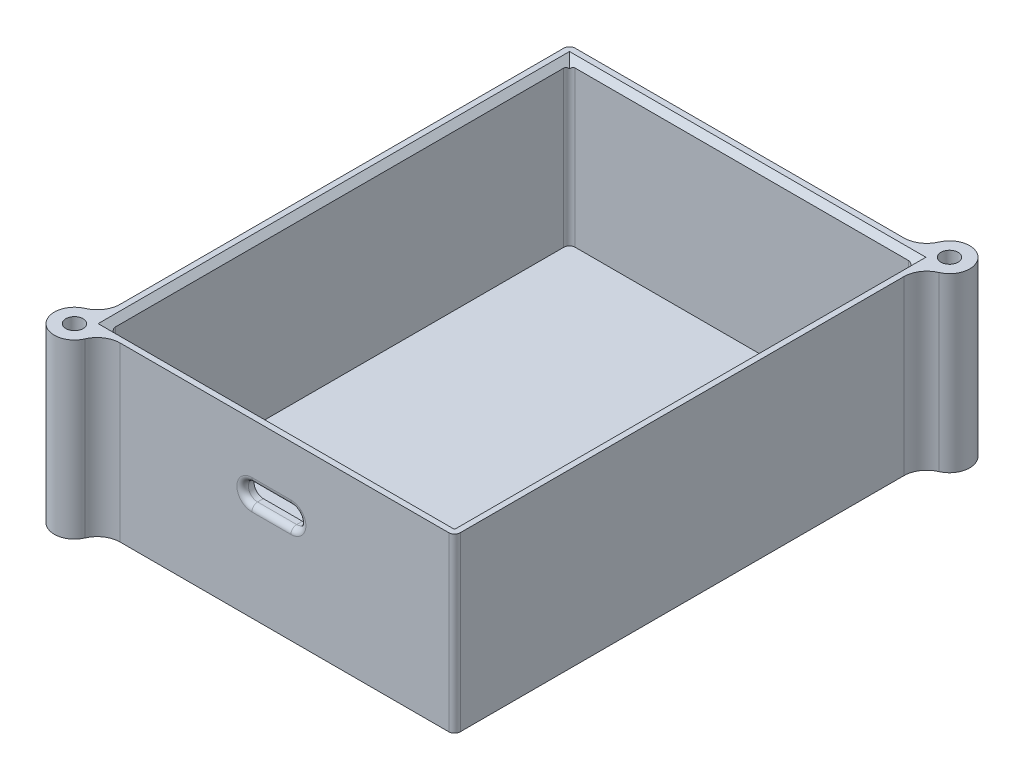
from build123d import *

# Parameters (mm, degrees)
SKETCH1_W           = 64
SKETCH1_H           = 84
SKETCH1_W_2         = 60
SKETCH1_H_2         = 80
BOSS_EXTRUDE1_DEPTH = 30
SKETCH2_R           = 3.5
SKETCH2_R_2         = 1.5
BOSS_EXTRUDE2_DEPTH = 30
CUT_EXTRUDE1_DEPTH  = 30
FILLET2_R           = 1
FILLET3_R           = 4
CHAMFER1_SIZE       = 1
FILLET4_R           = 1
FILLET5_R           = 1
BOSS_EXTRUDE3_REACH = 115.239
SKETCH6_W           = 82.053414124
SKETCH6_H           = 2


with BuildPart() as part:
    # Sketch1 → Boss-Extrude1 (new body)
    with BuildSketch(Plane(origin=(0, 0, 0), x_dir=(1, 0, 0), z_dir=(0, 1, 0))):
        with Locations((30, -40)):
            Rectangle(SKETCH1_W, SKETCH1_H)
        with Locations((30, -40)):
            Rectangle(SKETCH1_W_2, SKETCH1_H_2, mode=Mode.SUBTRACT)
    extrude(amount=BOSS_EXTRUDE1_DEPTH)

    # Sketch2 → Boss-Extrude2 (add)
    # profile 1 of 2: a face of its own
    with BuildSketch(Plane(origin=(0, 0, 0), x_dir=(1, 0, 0), z_dir=(0, 1, 0))):
        with Locations((-3.060660172, -83.060660172)):
            Circle(SKETCH2_R)
        with Locations((-3.060660172, -83.060660172)):
            Circle(SKETCH2_R_2, mode=Mode.SUBTRACT)
    # profile 2 of 2: a face of its own
    with BuildSketch(Plane(origin=(0, 0, 0), x_dir=(1, 0, 0), z_dir=(0, 1, 0))):
        with Locations((63.060660172, 3.060660172)):
            Circle(SKETCH2_R)
        with Locations((63.060660172, 3.060660172)):
            Circle(SKETCH2_R_2, mode=Mode.SUBTRACT)
    extrude(amount=BOSS_EXTRUDE2_DEPTH)

    # Sketch4 → Cut-Extrude1 (cut)
    with BuildSketch(Plane.XY.offset(82)):
        with BuildLine():
            Line((30.141314867, 20.2), (26.741314867, 20.2))
            ThreePointArc((26.741314867, 20.2), (25.141314867, 18.6), (26.741314867, 17))
            Line((26.741314867, 17), (30.141314867, 17))
            Line((30.141314867, 17), (33.541314867, 17))
            ThreePointArc((33.541314867, 17), (35.141314867, 18.6), (33.541314867, 20.2))
            Line((33.541314867, 20.2), (30.141314867, 20.2))
        make_face()
    extrude(amount=-CUT_EXTRUDE1_DEPTH, mode=Mode.SUBTRACT)

    # Fillet2
    fillet2_edges = [part.edges().sort_by_distance(p)[0] for p in [
        (25.141314867, 18.6, 82),
        (30.141314867, 20.2, 82),
        (35.141314867, 18.6, 82),
        (30.141314867, 17, 82),
    ]]
    fillet(fillet2_edges, radius=FILLET2_R)

    # Fillet3
    fillet3_edges = [part.edges().sort_by_distance(p)[0] for p in [
        (62, 15, 0.274755844),
        (59.725244156, 15, -2),
        (-2, 15, 79.725244156),
        (0.274755844, 15, 82),
    ]]
    fillet(fillet3_edges, radius=FILLET3_R)

    # Chamfer1
    chamfer1_edges = [part.edges().sort_by_distance(p)[0] for p in [
        (30, 30, 0),
        (60, 30, 40),
        (0, 30, 40),
        (30, 30, 80),
    ]]
    chamfer(chamfer1_edges, length=CHAMFER1_SIZE)

    # Fillet4
    fillet4_edges = [part.edges().sort_by_distance(p)[0] for p in [
        (-2, 15, -2),
        (62, 15, 82),
    ]]
    fillet(fillet4_edges, radius=FILLET4_R)

    # Fillet5
    fillet5_edges = [part.edges().sort_by_distance(p)[0] for p in [
        (60, 14.5, 80),
        (60, 14.5, 0),
        (0, 14.5, 0),
        (0, 14.5, 80),
    ]]
    fillet(fillet5_edges, radius=FILLET5_R)

    # Sketch6 → Boss-Extrude3 (add, up to next)
    with BuildSketch(Plane(origin=(0, 0, 0), x_dir=(0, 0, -1), z_dir=(1, 0, 0)), mode=Mode.PRIVATE) as boss_extrude3_sk1:
        with Locations((-39.973292938, 1)):
            Rectangle(SKETCH6_W, SKETCH6_H)
    boss_extrude3_tool1 = extrude(boss_extrude3_sk1.sketch, amount=BOSS_EXTRUDE3_REACH, mode=Mode.PRIVATE) - part.part
    add(boss_extrude3_tool1.solids().sort_by_distance((0, 1, 39.973293))[0])


solid = part.part
